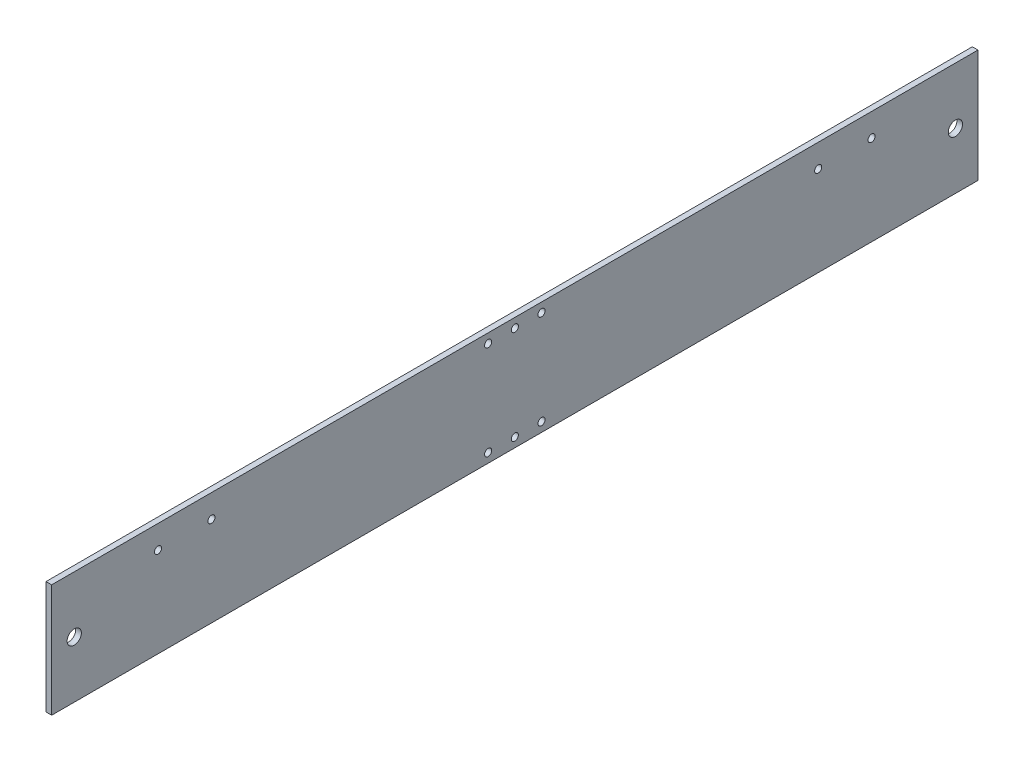
from build123d import *

# Parameters (mm, degrees)
SKETCH1_W           = 520.7
SKETCH1_H           = 63.5
SKETCH1_R           = 4
SKETCH1_R_2         = 2
BOSS_EXTRUDE2_DEPTH = 3.175


with BuildPart() as part:
    # Sketch1 → Boss-Extrude2 (new body)
    with BuildSketch(Plane(origin=(0, 0, 0), x_dir=(0, 0, -1), z_dir=(1, 0, 0))):
        with Locations((260.35, 31.75)):
            Rectangle(SKETCH1_W, SKETCH1_H)
        with Locations((12.7, 31.75)):
            Circle(SKETCH1_R, mode=Mode.SUBTRACT)
        with Locations((508, 31.75)):
            Circle(SKETCH1_R, mode=Mode.SUBTRACT)
        with Locations((245.35, 58.25)):
            Circle(SKETCH1_R_2, mode=Mode.SUBTRACT)
        with Locations((245.35, 5.25)):
            Circle(SKETCH1_R_2, mode=Mode.SUBTRACT)
        with Locations((260.35, 58.25)):
            Circle(SKETCH1_R_2, mode=Mode.SUBTRACT)
        with Locations((275.35, 58.25)):
            Circle(SKETCH1_R_2, mode=Mode.SUBTRACT)
        with Locations((260.35, 5.25)):
            Circle(SKETCH1_R_2, mode=Mode.SUBTRACT)
        with Locations((275.35, 5.25)):
            Circle(SKETCH1_R_2, mode=Mode.SUBTRACT)
        with Locations((59.825, 50.5)):
            Circle(SKETCH1_R_2, mode=Mode.SUBTRACT)
        with Locations((460.875, 50.5)):
            Circle(SKETCH1_R_2, mode=Mode.SUBTRACT)
        with Locations((89.825, 50.5)):
            Circle(SKETCH1_R_2, mode=Mode.SUBTRACT)
        with Locations((430.875, 50.5)):
            Circle(SKETCH1_R_2, mode=Mode.SUBTRACT)
    extrude(amount=BOSS_EXTRUDE2_DEPTH)


solid = part.part
